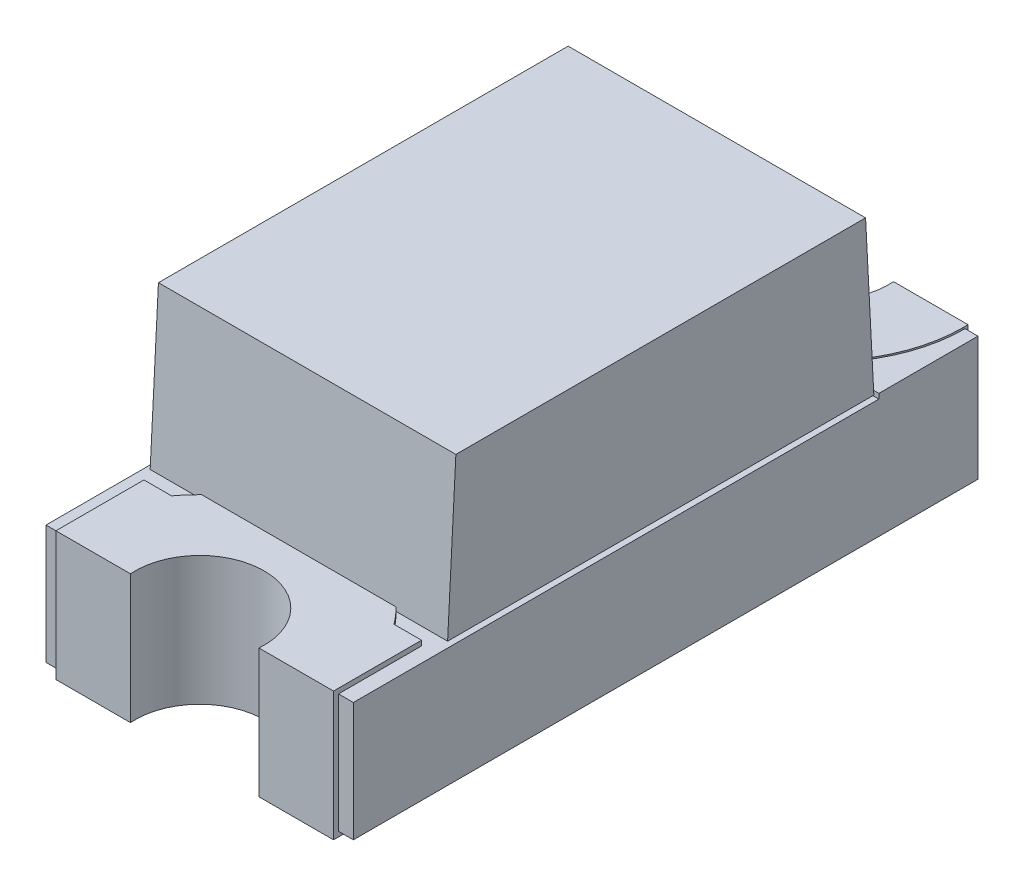
from build123d import *

# Parameters (mm, degrees)
BOSS_EXTRUDE1_DEPTH   = 0.3048
BOSS_EXTRUDE1_START   = -0.0127
BOSS_EXTRUDE1_2_DEPTH = 0.3302
BOSS_EXTRUDE1_3_DEPTH = 0.0127
SKETCH2_W             = 0.7112
SKETCH2_H             = 0.0127
CUT_EXTRUDE1_DEPTH    = 0.7112
SKETCH3_W             = 0.7112
SKETCH3_H             = 0.0127
CUT_EXTRUDE2_DEPTH    = 1.0922
BOSS_EXTRUDE2_DEPTH   = 0.0127
BOSS_EXTRUDE3_DEPTH   = 0.0127
CUT_EXTRUDE3_DEPTH    = 0.0127
CUT_EXTRUDE4_DEPTH    = 0.0127
BOSS_EXTRUDE4_DEPTH   = 0.00762
HOLE1_D               = 0.3302
BOSS_EXTRUDE5_DEPTH   = 0.762


with BuildPart() as part:
    # Boss-Extrude1: read off the stored shape, not the designer's step
    # Boss-Extrude1 outline → Boss-Extrude1 (new body)
    with BuildSketch(Plane(origin=(0, 0, 0), x_dir=(1, 0, 0), z_dir=(0, 1, 0))):
        Polygon((-0.3937, -0.8001), (-0.3556, -0.8001), (-0.3556, -0.8128), (0.3556, -0.8128), (0.3556, -0.8001), (0.3937, -0.8001), (0.3937, 0.8001), (0.3556, 0.8001), (0.3556, 0.8128), (-0.3556, 0.8128), (-0.3556, 0.8001), (-0.3937, 0.8001), align=None)
    extrude(amount=BOSS_EXTRUDE1_DEPTH)

    # Boss-Extrude1 2 outline → Boss-Extrude1 2 (add)
    with BuildSketch(Plane(origin=(0, 0, 0), x_dir=(1, 0, 0), z_dir=(0, 1, 0)).offset(BOSS_EXTRUDE1_START)):
        with BuildLine():
            Line((-0.3556, 0.8128), (-0.3556, 0.8001))
            ThreePointArc((-0.3556, 0.8001), (-0.327832943, 0.662343252), (-0.248868158, 0.5461))
            Line((-0.248868158, 0.5461), (-0.3556, 0.5461))
            Line((-0.3556, 0.5461), (-0.3556, -0.8128))
            Line((-0.3556, -0.8128), (0.3556, -0.8128))
            Line((0.3556, -0.8128), (0.3556, 0.5461))
            Line((0.3556, 0.5461), (0.248868158, 0.5461))
            ThreePointArc((0.248868158, 0.5461), (0.327832943, 0.662343252), (0.3556, 0.8001))
            Line((0.3556, 0.8001), (0.3556, 0.8128))
            Line((0.3556, 0.8128), (-0.3556, 0.8128))
        make_face()
    extrude(amount=BOSS_EXTRUDE1_2_DEPTH)

    # Boss-Extrude1 3 outline → Boss-Extrude1 3 (add)
    with BuildSketch(Plane(origin=(0, 0, 0), x_dir=(1, 0, 0), z_dir=(0, 1, 0)).offset(BOSS_EXTRUDE1_START)):
        with BuildLine():
            ThreePointArc((-0.248868158, 0.5461), (-0.327832943, 0.662343252), (-0.3556, 0.8001))
            Line((-0.3556, 0.8001), (-0.3556, 0.5461))
            Line((-0.3556, 0.5461), (-0.248868158, 0.5461))
        make_face()
        with BuildLine():
            Line((0.3556, 0.5461), (0.3556, 0.8001))
            ThreePointArc((0.3556, 0.8001), (0.327832943, 0.662343252), (0.248868158, 0.5461))
            Line((0.248868158, 0.5461), (0.3556, 0.5461))
        make_face()
    extrude(amount=BOSS_EXTRUDE1_3_DEPTH)

    # Sketch2 → Cut-Extrude1 (cut)
    with BuildSketch(Plane(origin=(0, 0, -0.3556), x_dir=(-1, 0, 0), z_dir=(0, 0, -1))):
        with Locations((0, -0.00635)):
            Rectangle(SKETCH2_W, SKETCH2_H)
    extrude(amount=-CUT_EXTRUDE1_DEPTH, mode=Mode.SUBTRACT)

    # Sketch3 → Cut-Extrude2 (cut)
    with BuildSketch(Plane(origin=(0, 0, -0.5461), x_dir=(-1, 0, 0), z_dir=(0, 0, -1))):
        with Locations((0, 0.31115)):
            Rectangle(SKETCH3_W, SKETCH3_H)
    extrude(amount=-CUT_EXTRUDE2_DEPTH, mode=Mode.SUBTRACT)

    # Sketch4 → Boss-Extrude2 (add)
    with BuildSketch(Plane(origin=(0, 0.3048, 0), x_dir=(-1, 0, 0), z_dir=(0, 1, 0))):
        with BuildLine():
            Line((-0.3937, -0.5461), (-0.25607433, -0.5461))
            ThreePointArc((-0.25607433, -0.5461), (-0.333504836, -0.662751587), (-0.36068, -0.8001))
            Line((-0.36068, -0.8001), (-0.3937, -0.8001))
            Line((-0.3937, -0.8001), (-0.3937, -0.5461))
        make_face()
    extrude(amount=BOSS_EXTRUDE2_DEPTH)

    # Sketch5 → Boss-Extrude3 (add)
    with BuildSketch(Plane(origin=(0, 0.3048, 0), x_dir=(-1, 0, 0), z_dir=(0, 1, 0))):
        with BuildLine():
            Line((0.25607433, -0.5461), (0.3937, -0.5461))
            Line((0.3937, -0.5461), (0.3937, -0.8001))
            Line((0.3937, -0.8001), (0.36068, -0.8001))
            ThreePointArc((0.36068, -0.8001), (0.333504836, -0.662751587), (0.25607433, -0.5461))
        make_face()
    extrude(amount=BOSS_EXTRUDE3_DEPTH)

    # Sketch6 → Cut-Extrude3 (cut)
    with BuildSketch(Plane(origin=(0, 0.3175, 0), x_dir=(-1, 0, 0), z_dir=(0, 1, 0))):
        with BuildLine():
            Line((0.3556, 0.5461), (0.3556, 0.587289823))
            Line((0.3556, 0.587289823), (0.284891538, 0.587289823))
            ThreePointArc((0.284891538, 0.587289823), (0.267673315, 0.566000969), (0.248868158, 0.5461))
            Line((0.248868158, 0.5461), (0.3556, 0.5461))
        make_face()
    extrude(amount=-CUT_EXTRUDE3_DEPTH, mode=Mode.SUBTRACT)

    # Sketch7 → Cut-Extrude4 (cut)
    with BuildSketch(Plane(origin=(0, 0.3175, 0), x_dir=(-1, 0, 0), z_dir=(0, 1, 0))):
        with BuildLine():
            Line((-0.284891538, 0.587289823), (-0.3556, 0.587289823))
            Line((-0.3556, 0.587289823), (-0.3556, 0.5461))
            Line((-0.3556, 0.5461), (-0.248868158, 0.5461))
            ThreePointArc((-0.248868158, 0.5461), (-0.267673315, 0.566000969), (-0.284891538, 0.587289823))
        make_face()
    extrude(amount=-CUT_EXTRUDE4_DEPTH, mode=Mode.SUBTRACT)

    # Sketch8 → Boss-Extrude4 (add)
    with BuildSketch(Plane.XZ):
        Polygon((0, -0.254), (-0.293293937, 0.254), (0.293293937, 0.254), align=None)
    extrude(amount=BOSS_EXTRUDE4_DEPTH)

    # Hole1 (through all)
    with Locations(Plane(origin=(0, -0.0127, 0), x_dir=(-1, 0, 0), z_dir=(0, -1, 0))):
        with Locations((0, 0.8001), (0, -0.8001)):
            Hole(HOLE1_D / 2)


with BuildPart() as body_2:
    # Sketch15 → Boss-Extrude5 (new body)
    with BuildSketch(Plane.ZY.offset(0.381)):
        Polygon((-0.524801478, 0.7112), (-0.545966884, 0.30734), (0.545966884, 0.30734), (0.524801478, 0.7112), align=None)
    extrude(amount=-BOSS_EXTRUDE5_DEPTH)


solid = Compound([part.part, body_2.part])
